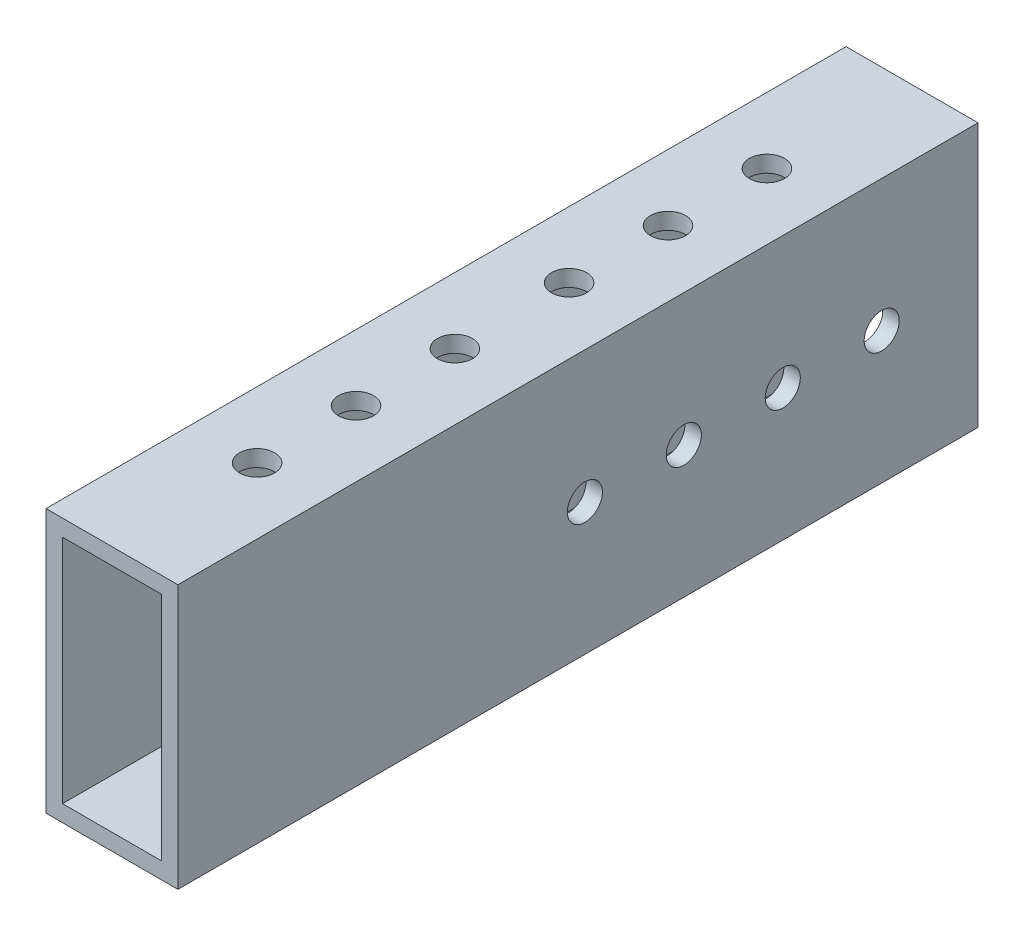
from build123d import *

# Parameters (mm, degrees)
SKETCH1_W           = 25.4
SKETCH1_H           = 50.8
SKETCH1_W_2         = 19.05
SKETCH1_H_2         = 44.45
BOSS_EXTRUDE1_DEPTH = 154.051
SKETCH2_R           = 3.3782
CUT_EXTRUDE1_DEPTH  = 165.187425222
SKETCH3_R           = 3.3782
CUT_EXTRUDE2_DEPTH  = 165.187425222


with BuildPart() as part:
    # Sketch1 → Boss-Extrude1 (new body)
    with BuildSketch(Plane.XY):
        with Locations((12.7, 25.4)):
            Rectangle(SKETCH1_W, SKETCH1_H)
        with Locations((12.7, 25.4)):
            Rectangle(SKETCH1_W_2, SKETCH1_H_2, mode=Mode.SUBTRACT)
    extrude(amount=BOSS_EXTRUDE1_DEPTH)

    # Sketch2 → Cut-Extrude1 (cut, through all)
    with BuildSketch(Plane(origin=(0, 50.8, 0), x_dir=(1, 0, 0), z_dir=(0, 1, 0))):
        with Locations((12.7, -126.111)):
            Circle(SKETCH2_R)
        with Locations((12.7, -107.061)):
            Circle(SKETCH2_R)
        with Locations((12.7, -88.011)):
            Circle(SKETCH2_R)
        with Locations((12.7, -27.94)):
            Circle(SKETCH2_R)
        with Locations((12.7, -46.99)):
            Circle(SKETCH2_R)
        with Locations((12.7, -66.04)):
            Circle(SKETCH2_R)
    extrude(amount=-CUT_EXTRUDE1_DEPTH, mode=Mode.SUBTRACT)

    # Sketch3 → Cut-Extrude2 (cut, through all)
    with BuildSketch(Plane(origin=(25.4, 0, 0), x_dir=(0, 0, -1), z_dir=(1, 0, 0))):
        with Locations((-18.542, 25.4)):
            Circle(SKETCH3_R)
        with Locations((-37.592, 25.4)):
            Circle(SKETCH3_R)
        with Locations((-56.642, 25.4)):
            Circle(SKETCH3_R)
        with Locations((-75.692, 25.4)):
            Circle(SKETCH3_R)
    extrude(amount=-CUT_EXTRUDE2_DEPTH, mode=Mode.SUBTRACT)


solid = part.part
